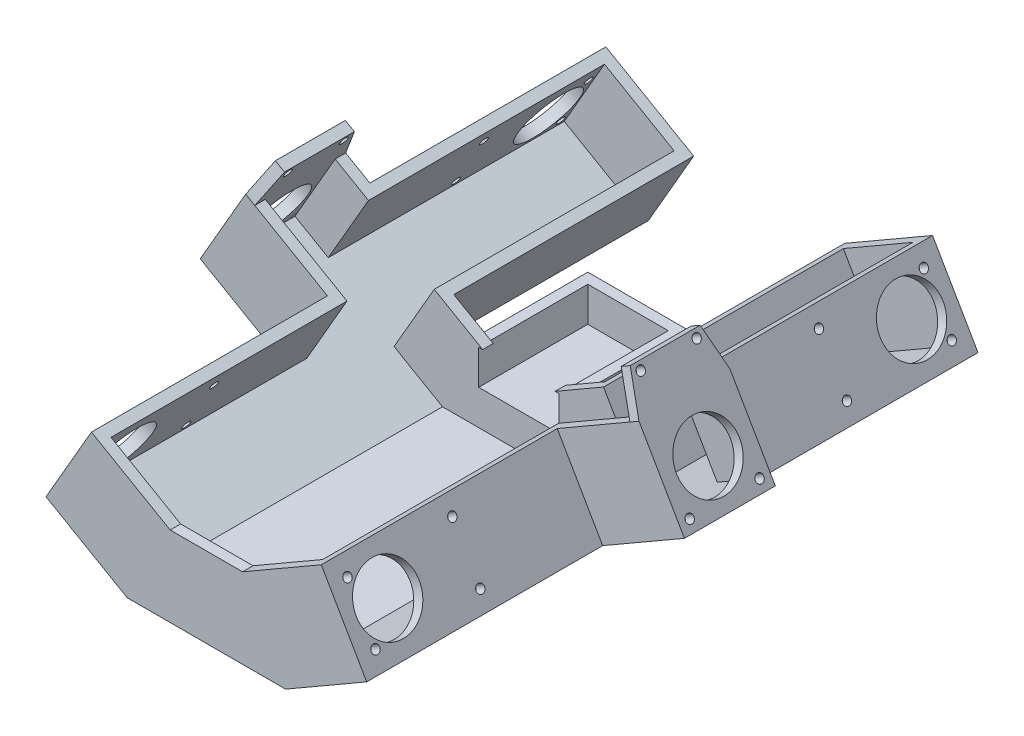
from build123d import *

# Parameters (mm, degrees)
BOSS_EXTRUDE1_DEPTH            = 23
BODY_MOVE_COPY1_ANGLE          = 30
BOSS_EXTRUDE2_DEPTH            = 77.5
BOSS_EXTRUDE2_DEPTH_BACK       = 8.89744
SKETCH13_W                     = 11.5
SKETCH13_H                     = 9.918584287
BOSS_EXTRUDE4_DEPTH            = 31.21169
SHELL1_START                   = 11.5
SHELL1_DEPTH                   = 3
SHELL1_2_DEPTH                 = 22.653212483
SHELL1_3_DEPTH                 = 11.5
SHELL1_4_DEPTH                 = 22.653212483
SHELL1_5_DEPTH                 = 11.5
SHELL1_6_DEPTH                 = 11.153212483
SHELL1_START_2                 = -77.5
SHELL1_7_DEPTH                 = 87.5
SHELL1_START_3                 = -8.897442479
SHELL1_8_DEPTH                 = 86.397442477
SHELL1_START_4                 = -10
SHELL1_9_DEPTH                 = 20
SHELL1_START_5                 = -80.5
SHELL1_10_DEPTH                = 70.5
SHELL1_START_6                 = 10
SHELL1_11_DEPTH                = 70.499999998
SHELL1_START_7                 = -11.897442479
SHELL1_12_DEPTH                = 24.897442479
SHELL1_13_DEPTH                = 3
SHELL1_14_DEPTH                = 3
SHELL1_START_8                 = 77.499999998
SHELL1_15_DEPTH                = 3
SHELL1_16_DEPTH                = 1.897442479
SHELL1_START_9                 = -13
SHELL1_17_DEPTH                = 1.102557521
SHELL1_START_10                = -10.287226583
SHELL1_18_DEPTH                = 1.389784104
CUT_EXTRUDE2_REACH             = 111.579
SKETCH6_R                      = 9
BOSS_EXTRUDE3_DEPTH            = 3
M2_START                       = 36
M2_CLEARANCE_HOLE1_OUTLINE_R   = 1.2
M2_CLEARANCE_HOLE1_DEPTH       = 30.676914536
M2_START_2                     = 63.676914536
M2_CLEARANCE_HOLE1_2_OUTLINE_R = 1.2
M2_CLEARANCE_HOLE1_2_DEPTH     = 3


with BuildPart() as part:
    # Sketch2 → Boss-Extrude1 (new body)
    with BuildSketch(Plane(origin=(0, 0, 0), x_dir=(1, 0, 0), z_dir=(0, 1, 0))):
        Polygon((11, -77.499999998), (34, -77.499999998), (34, -10), (61, -10), (61, 10), (50, 10), (50, 77.5), (27, 77.5), (27, 8.897442479), (11, 8.897442479), align=None)
    extrude(amount=BOSS_EXTRUDE1_DEPTH)


with BuildPart() as part_1:
    # Body-Move/Copy1: moved
    add(part.part.rotate(Axis((36, 15, 0), (0, 0, 1)), BODY_MOVE_COPY1_ANGLE))

    # Sketch7 → Boss-Extrude2 (add, two sides: drawn at the far end of the back side and taken through both)
    with BuildSketch(Plane.XY.offset(-BOSS_EXTRUDE2_DEPTH_BACK)):
        Polygon((10.349364905, 9.42820323), (0, 9.42820323), (0, -10.490381057), (21.849364905, -10.490381057), align=None)
    extrude(amount=BOSS_EXTRUDE2_DEPTH + BOSS_EXTRUDE2_DEPTH_BACK)


with BuildPart() as boss_extrude4_tool:
    # Sketch13 → Boss-Extrude4 (new body)
    with BuildSketch(Plane(origin=(0, 0, -8.897442479), x_dir=(-1, 0, 0), z_dir=(0, 0, -1))):
        with Locations((-5.75, 4.468911087)):
            Rectangle(SKETCH13_W, SKETCH13_H)
    extrude(amount=BOSS_EXTRUDE4_DEPTH)


with BuildPart() as part_2:
    add(part_1.part)


with BuildPart() as part_3:
    # Boss-Extrude4: joined with boss_extrude4_tool
    add(part_2.part.fuse(boss_extrude4_tool.part, tol=0.00001))

    # Shell1: read off the stored shape, not the designer's step
    # Shell1 outline → Shell1 (add)
    with BuildSketch(Plane.YZ.offset(SHELL1_START)):
        Polygon((9.42820323, -13), (9.42820323, -11.897442479), (-3.490381057, -11.897442479), (-3.490381057, -43.109132218), (9.42820323, -43.109132218), align=None)
    extrude(amount=SHELL1_DEPTH)

    # Shell1 2 outline → Shell1 2 (cut)
    with BuildSketch(Plane.YZ):
        Polygon((9.42820323, 13), (9.42820323, 77.499999998), (-10.490381057, 77.499999998), (-10.490381057, -8.897442479), (9.42820323, -8.897442479), (9.42820323, 10), align=None)
    extrude(amount=SHELL1_2_DEPTH, mode=Mode.SUBTRACT)

    # Shell1 3 outline → Shell1 3 (cut)
    with BuildSketch(Plane.YZ):
        Polygon((9.42820323, -10), (9.42820323, -8.897442479), (-0.490381057, -8.897442479), (-0.490381057, -40.109132218), (9.42820323, -40.109132218), (9.42820323, -13), align=None)
    extrude(amount=SHELL1_3_DEPTH, mode=Mode.SUBTRACT)

    # Shell1 4 outline → Shell1 4 (add)
    with BuildSketch(Plane.YZ):
        Polygon((9.42820323, 77.499999998), (9.42820323, 80.499999998), (-13.490381057, 80.499999998), (-13.490381057, -11.897442479), (-0.490381057, -11.897442479), (-0.490381057, -8.897442479), (-10.490381057, -8.897442479), (-10.490381057, 77.499999998), align=None)
    extrude(amount=SHELL1_4_DEPTH)

    # Shell1 5 outline → Shell1 5 (add)
    with BuildSketch(Plane.YZ):
        Polygon((-0.490381057, -11.897442479), (-3.490381057, -11.897442479), (-3.490381057, -43.109132218), (9.42820323, -43.109132218), (9.42820323, -40.109132218), (-0.490381057, -40.109132218), align=None)
    extrude(amount=SHELL1_5_DEPTH)

    # Shell1 6 outline → Shell1 6 (add)
    with BuildSketch(Plane.YZ.offset(SHELL1_START)):
        Polygon((9.42820323, -10), (9.42820323, -8.897442479), (-0.490381057, -8.897442479), (-0.490381057, -11.897442479), (9.42820323, -11.897442479), align=None)
    extrude(amount=SHELL1_6_DEPTH)

    # Shell1 7 outline → Shell1 7 (cut)
    with BuildSketch(Plane.XY.offset(SHELL1_START_2)):
        Polygon((44.124355653, 28.92820323), (24.205771366, 17.42820323), (35.705771366, -2.490381057), (55.624355653, 9.009618943), align=None)
    extrude(amount=SHELL1_7_DEPTH, mode=Mode.SUBTRACT)

    # Shell1 8 outline → Shell1 8 (cut)
    with BuildSketch(Plane.XY.offset(SHELL1_START_3)):
        Polygon((41.767949192, 1.009618943), (30.267949192, 20.92820323), (10.349364905, 9.42820323), (22.653212483, 9.42820323), (22.653212483, -10.026279441), align=None)
    extrude(amount=SHELL1_8_DEPTH, mode=Mode.SUBTRACT)

    # Shell1 9 outline → Shell1 9 (cut)
    with BuildSketch(Plane.XY.offset(SHELL1_START_4)):
        Polygon((44.124355653, 28.92820323), (55.624355653, 9.009618943), (65.150635095, 14.509618943), (53.650635095, 34.42820323), align=None)
    extrude(amount=SHELL1_9_DEPTH, mode=Mode.SUBTRACT)

    # Shell1 11 outline → Shell1 11 (add)
    with BuildSketch(Plane.XY.offset(SHELL1_START_6)):
        Polygon((32.866025404, 22.42820323), (30.267949192, 20.92820323), (41.767949192, 1.009618943), (21.849364905, -10.490381057), (22.653212483, -10.490381057), (22.653212483, -13.490381057), (45.866025404, -0.088457268), align=None)
    extrude(amount=SHELL1_11_DEPTH)



with BuildPart() as body_2:
    # Shell1 10 outline → Shell1 10 (new body)
    with BuildSketch(Plane.XY.offset(SHELL1_START_5)):
        Polygon((55.624355653, 9.009618943), (35.705771366, -2.490381057), (24.205771366, 17.42820323), (21.607695155, 15.92820323), (34.607695155, -6.588457268), (59.722431864, 7.911542732), (46.722431864, 30.42820323), (44.124355653, 28.92820323), align=None)
    extrude(amount=SHELL1_10_DEPTH)


with BuildPart() as part_4:
    add(part_3.part)

    add(body_2.part)  # Shell1 12 merges body 2
    # Shell1 12 outline → Shell1 12 (add)
    with BuildSketch(Plane.XY.offset(SHELL1_START_7)):
        Polygon((21.849364905, -10.490381057), (22.653212483, -10.490381057), (22.653212483, -13.490381057), (69.248711306, 13.411542732), (56.248711306, 35.92820323), (53.650635095, 34.42820323), (65.150635095, 14.509618943), align=None)
    extrude(amount=SHELL1_12_DEPTH)

    # Shell1 13 outline → Shell1 13 (add)
    with BuildSketch(Plane.XY.offset(SHELL1_START_6)):
        Polygon((32.866025404, 22.42820323), (44.366025404, 2.509618943), (65.150635095, 14.509618943), (53.650635095, 34.42820323), align=None)
    extrude(amount=SHELL1_13_DEPTH)

    # Shell1 14 outline → Shell1 14 (add)
    with BuildSketch(Plane.XY.offset(SHELL1_START_5)):
        Polygon((44.124355653, 28.92820323), (24.205771366, 17.42820323), (35.705771366, -2.490381057), (55.624355653, 9.009618943), align=None)
    extrude(amount=SHELL1_14_DEPTH)

    # Shell1 15 outline → Shell1 15 (add)
    with BuildSketch(Plane.XY.offset(SHELL1_START_8)):
        Polygon((41.767949192, 1.009618943), (30.267949192, 20.92820323), (10.349364905, 9.42820323), (22.653212483, 9.42820323), (22.653212483, -10.026279441), align=None)
    extrude(amount=SHELL1_15_DEPTH)

    # Shell1 16 outline → Shell1 16 (add)
    with BuildSketch(Plane.XY.offset(SHELL1_START_7)):
        Polygon((53.650635095, 34.42820323), (46.722431864, 30.42820323), (58.222431864, 10.509618943), (65.150635095, 14.509618943), align=None)
        Polygon((33.107695155, -3.990381057), (21.607695155, 15.92820323), (10.349364905, 9.42820323), (22.653212483, 9.42820323), (22.653212483, -10.026279441), align=None)
    extrude(amount=SHELL1_16_DEPTH)

    # Shell1 17 outline → Shell1 17 (add)
    with BuildSketch(Plane.XY.offset(SHELL1_START_9)):
        Polygon((46.722431864, 30.42820323), (59.722431864, 7.911542732), (69.248711306, 13.411542732), (56.248711306, 35.92820323), align=None)
    extrude(amount=SHELL1_17_DEPTH)

    # Shell1 18 outline → Shell1 18 (add)
    with BuildSketch(Plane.XY.offset(SHELL1_START_10)):
        Polygon((35.705771366, -2.490381057), (24.205771366, 17.42820323), (10.349364905, 9.42820323), (22.653212483, 9.42820323), (22.653212483, -10.026279441), align=None)
    extrude(amount=SHELL1_18_DEPTH)

    # Sketch6 → Cut-Extrude2 (cut, up to next)
    with BuildSketch(Plane(origin=(57.743901834, 33.338457268, 0), x_dir=(0, 0, -1), z_dir=(0.8660254037842566, 0.5000000000003155, 0)), mode=Mode.PRIVATE) as cut_extrude2_sk1:
        with Locations(Location((-67.999999998, -10.009618943, 0), (0, 0, 270))):
            Circle(SKETCH6_R)
    cut_extrude2_tool1 = extrude(cut_extrude2_sk1.sketch, amount=-CUT_EXTRUDE2_REACH, mode=Mode.PRIVATE) & part_4.part
    # Sketch6 → Cut-Extrude2 (cut, up to next)
    with BuildSketch(Plane(origin=(57.743901834, 33.338457268, 0), x_dir=(0, 0, -1), z_dir=(0.8660254037842566, 0.5000000000003155, 0)), mode=Mode.PRIVATE) as cut_extrude2_sk2:
        with Locations(Location((0, -10.509618943, 0), (0, 0, 90))):
            Circle(SKETCH6_R)
    cut_extrude2_tool2 = extrude(cut_extrude2_sk2.sketch, amount=-CUT_EXTRUDE2_REACH, mode=Mode.PRIVATE) & part_4.part
    # Sketch6 → Cut-Extrude2 (cut, up to next)
    with BuildSketch(Plane(origin=(57.743901834, 33.338457268, 0), x_dir=(0, 0, -1), z_dir=(0.8660254037842566, 0.5000000000003155, 0)), mode=Mode.PRIVATE) as cut_extrude2_sk3:
        with Locations(Location((68, -10.009618943, 0), (0, 0, 270))):
            Circle(SKETCH6_R)
    cut_extrude2_tool3 = extrude(cut_extrude2_sk3.sketch, amount=-CUT_EXTRUDE2_REACH, mode=Mode.PRIVATE) & part_4.part
    add(cut_extrude2_tool1.solids().sort_by_distance((62.748711, 24.669873, 68))[0], mode=Mode.SUBTRACT)
    add(cut_extrude2_tool2.solids().sort_by_distance((62.998711, 24.23686, 0))[0], mode=Mode.SUBTRACT)
    add(cut_extrude2_tool3.solids().sort_by_distance((62.748711, 24.669873, -68))[0], mode=Mode.SUBTRACT)

    # Sketch11 → Boss-Extrude3 (add)
    with BuildSketch(Plane(origin=(57.743901834, 33.338457268, 0), x_dir=(0, 0, -1), z_dir=(0.8660254037842566, 0.5000000000003155, 0))):
        Polygon((-13, 2.990381057), (-10, 13.990381057), (10, 13.990381057), (13, 2.990381057), align=None)
    extrude(amount=-BOSS_EXTRUDE3_DEPTH)

    # M2 Clearance Hole1: read off the stored shape, not the designer's step
    # M2 Clearance Hole1 outline → M2 Clearance Hole1 (cut)
    with BuildSketch(Plane(origin=(0, 0, 0), x_dir=(0.5000000000003147, -0.8660254037842569, 0), z_dir=(0.8660254037842569, 0.500000000000315, 0)).offset(M2_START)):
        with Locations((-11.990381057, 8)):
            Circle(M2_CLEARANCE_HOLE1_OUTLINE_R)
        with Locations((-11.990381057, -8)):
            Circle(M2_CLEARANCE_HOLE1_OUTLINE_R)
        with Locations((18.009618943, -75.499999998)):
            Circle(M2_CLEARANCE_HOLE1_OUTLINE_R)
        with Locations((2.009618943, -75.499999998)):
            Circle(M2_CLEARANCE_HOLE1_OUTLINE_R)
        with Locations((18.009618943, -45.499999998)):
            Circle(M2_CLEARANCE_HOLE1_OUTLINE_R)
        with Locations((2.009618943, -45.499999998)):
            Circle(M2_CLEARANCE_HOLE1_OUTLINE_R)
        with Locations((18.009618943, 75.5)):
            Circle(M2_CLEARANCE_HOLE1_OUTLINE_R)
        with Locations((2.009618943, 75.5)):
            Circle(M2_CLEARANCE_HOLE1_OUTLINE_R)
        with Locations((2.009618943, 45.5)):
            Circle(M2_CLEARANCE_HOLE1_OUTLINE_R)
        with Locations((18.009618943, 45.5)):
            Circle(M2_CLEARANCE_HOLE1_OUTLINE_R)
    extrude(amount=M2_CLEARANCE_HOLE1_DEPTH, mode=Mode.SUBTRACT)

    # M2 Clearance Hole1 2 outline → M2 Clearance Hole1 2 (cut)
    with BuildSketch(Plane(origin=(0, 0, 0), x_dir=(0.5000000000003147, -0.8660254037842569, 0), z_dir=(0.8660254037842569, 0.500000000000315, 0)).offset(M2_START_2)):
        with Locations((20.009618943, 10)):
            Circle(M2_CLEARANCE_HOLE1_2_OUTLINE_R)
        with Locations((20.009618943, -10)):
            Circle(M2_CLEARANCE_HOLE1_2_OUTLINE_R)
    extrude(amount=M2_CLEARANCE_HOLE1_2_DEPTH, mode=Mode.SUBTRACT)

    # Mirror1: part across plane


with BuildPart() as part_5:
    add(part_4.part)
    add(part_4.part.mirror(Plane(origin=(0, 0, 0), x_dir=(0, 0, 1), z_dir=(1, 0, 0))))


solid = part_5.part
